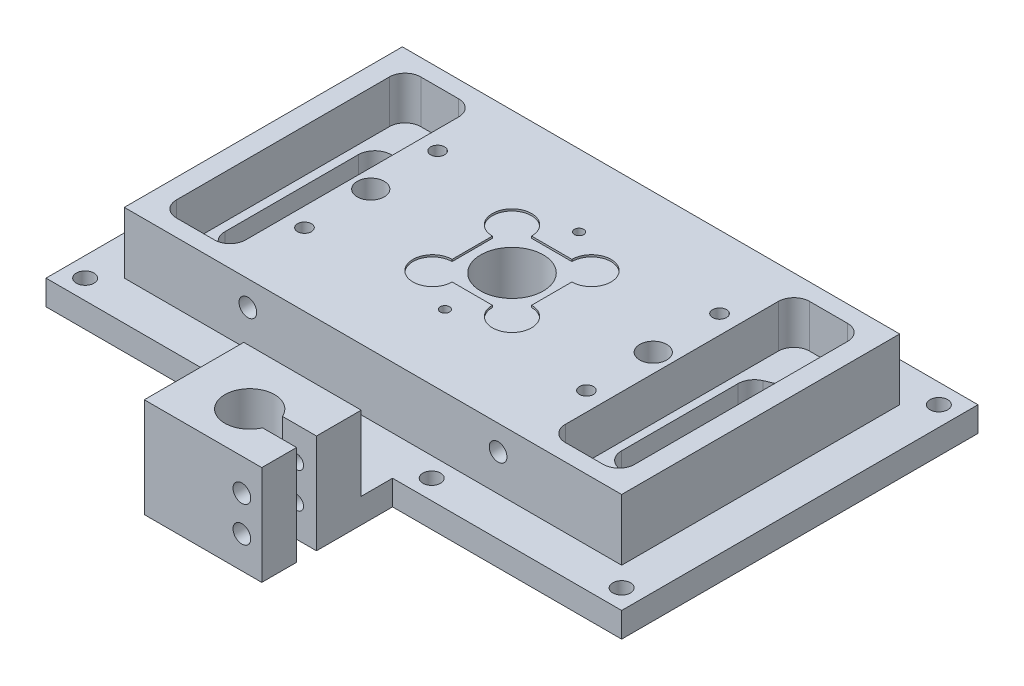
from build123d import *

# Parameters (mm, degrees)
MAIN_SKETCH_W                           = 73.5
MAIN_SKETCH_H                           = 45.5
MAIN_SKETCH_W_2                         = 63.5
MAIN_SKETCH_H_2                         = 35.5
LIP_DEPTH                               = 3.175
MOUNTING_BASE_OUTLINE_W                 = 63.5
MOUNTING_BASE_OUTLINE_H                 = 35.5
MOUNTING_BASE_OUTLINE_R                 = 1.7272
MOUNTING_BASE_OUTLINE_R_2               = 4
MOUNTING_BASE_DEPTH                     = 11
HEATER_CART_4_40_TAPS_D                 = 2.2606
HEATER_CART_4_40_TAPS_DEPTH             = 7.595
HEATER_CART_4_40_TAPS_TIP               = 0.679152758
HEATER_CART_4_40_TAPS_ON_FACE_2_D       = 2.2606
HEATER_CART_4_40_TAPS_ON_FACE_2_DEPTH   = 7.595
HEATER_CART_4_40_TAPS_ON_FACE_2_TIP     = 0.679152758
MAIN_SKETCH_12_W                        = 8.85
MAIN_SKETCH_12_H                        = 31.2
BOTTOM_SQUARE_CUTOUT_DEPTH              = 2
SQUARE_MICRO_D_CUTOUT_START             = 5.5
SQUARE_MICRO_D_CUTOUT_OUTLINE_W         = 8.85
SQUARE_MICRO_D_CUTOUT_OUTLINE_H         = 31.2
SQUARE_MICRO_D_CUTOUT_DEPTH             = 5.5
MAIN_SKETCH_7_R                         = 0.285
ROUND_MICRO_D_CUTOUT_DEPTH              = 11
INTERNAL_CORNER_CUTOUTS_FILLET_R        = 2
CHIP_CLAMP_0_80_TAPS_AT_2_COUNT         = 2
CHIP_CLAMP_0_80_TAPS_AT_2_PITCH         = 17.1232
CHIP_CLAMP_0_80_TAPS_AT_3_COUNT         = 2
CHIP_CLAMP_0_80_TAPS_AT_3_PITCH         = 17.1232
CHIP_POCKET_START                       = 11
MAIN_SKETCH_6_R                         = 2.5
MAIN_SKETCH_6_W                         = 10.15
MAIN_SKETCH_6_H                         = 10.15
CHIP_POCKET_DEPTH                       = 0.25
F_2_56_CLOSE_CLEAR_43_0_089_D           = 2.2606
F_2_56_CLOSE_CLEAR_43_0_089_ON_FACE_2_D = 2.2606
PCB_2_56_TAPS_D                         = 1.778
PCB_2_56_TAPS_DEPTH                     = 5.734
PCB_2_56_TAPS_TIP                       = 0.53416509
BOTTOM_COVER_2_56_TAPS_D                = 1.778
BOTTOM_COVER_2_56_TAPS_DEPTH            = 5.734
BOTTOM_COVER_2_56_TAPS_TIP              = 0.53416509
C_CLAMP_SKETCH_W                        = 15
C_CLAMP_SKETCH_H                        = 4
CCLAMP_BRIDGE_DEPTH                     = 3.175
C_CLAMP_START                           = -3.175
C_CLAMP_DEPTH                           = 12.7
C_CLAMP_HOLE_LOCS_R                     = 1.1303
F_2_56_CLSOE_FIT_THRU_DEPTH             = 4.445
F_2_56_TAPPED_HOLE2_D                   = 1.778
F_2_56_TAPPED_HOLE2_DEPTH               = 14.715


# Read off the part's stored shape, not the designer's step: Mounting_Base, Square_Micro_D_Cutout
with BuildPart() as part:
    # Main_Sketch → Lip (new body)
    with BuildSketch(Plane(origin=(0, 0, 0), x_dir=(1, 0, 0), z_dir=(0, 1, 0))):
        with Locations((36.75, -22.75)):
            Rectangle(MAIN_SKETCH_W, MAIN_SKETCH_H)
        with Locations((36.75, -22.75)):
            Rectangle(MAIN_SKETCH_W_2, MAIN_SKETCH_H_2, mode=Mode.SUBTRACT)
    extrude(amount=LIP_DEPTH)

    # Mounting_Base outline → Mounting_Base (add)
    with BuildSketch(Plane(origin=(0, 0, 0), x_dir=(1, 0, 0), z_dir=(0, 1, 0))):
        with Locations((36.75, -22.75)):
            Rectangle(MOUNTING_BASE_OUTLINE_W, MOUNTING_BASE_OUTLINE_H)
        with Locations((18.715, -22.75)):
            Circle(MOUNTING_BASE_OUTLINE_R, mode=Mode.SUBTRACT)
        with Locations((36.75, -22.75)):
            Circle(MOUNTING_BASE_OUTLINE_R_2, mode=Mode.SUBTRACT)
        with Locations((54.785, -22.75)):
            Circle(MOUNTING_BASE_OUTLINE_R, mode=Mode.SUBTRACT)
    extrude(amount=MOUNTING_BASE_DEPTH)

    # Heater_Cart_#4-40_Taps
    with Locations(Plane(origin=(52.725, 7.825, 5), x_dir=(-1, 0, 0), z_dir=(0, 0, -1))):
        with Locations((0, 0), (31.95, 0)):
            Hole(HEATER_CART_4_40_TAPS_D / 2, depth=HEATER_CART_4_40_TAPS_DEPTH)
            with Locations((0, 0, -(HEATER_CART_4_40_TAPS_DEPTH + HEATER_CART_4_40_TAPS_TIP / 2))):  # 118° drill point
                Cone(0, HEATER_CART_4_40_TAPS_D / 2, HEATER_CART_4_40_TAPS_TIP, mode=Mode.SUBTRACT)

    # Heater_Cart_#4-40_Taps on face 2
    with Locations(Plane(origin=(20.775, 7.825, 40.5), x_dir=(1, 0, 0), z_dir=(0, 0, 1))):
        with Locations((0, 0), (31.95, 0)):
            Hole(HEATER_CART_4_40_TAPS_ON_FACE_2_D / 2, depth=HEATER_CART_4_40_TAPS_ON_FACE_2_DEPTH)
            with Locations((0, 0, -(HEATER_CART_4_40_TAPS_ON_FACE_2_DEPTH + HEATER_CART_4_40_TAPS_ON_FACE_2_TIP / 2))):  # 118° drill point
                Cone(0, HEATER_CART_4_40_TAPS_ON_FACE_2_D / 2, HEATER_CART_4_40_TAPS_ON_FACE_2_TIP, mode=Mode.SUBTRACT)

    # Main_Sketch<12> → Bottom_square_cutout (cut)
    with BuildSketch(Plane(origin=(0, 0, 0), x_dir=(1, 0, 0), z_dir=(0, 1, 0))):
        with Locations((11.925, -22.75)):
            Rectangle(MAIN_SKETCH_12_W, MAIN_SKETCH_12_H)
        with BuildLine():
            ThreePointArc((11.521574965, -33.196222286), (10.496212222, -33.351578951), (9.521946869, -32.996175702))
            ThreePointArc((9.521946869, -32.996175702), (8.851632057, -32.244424217), (8.609546604, -31.26675))
            Line((8.609546604, -31.26675), (8.609546604, -14.23325))
            ThreePointArc((8.609546604, -14.23325), (8.851632057, -13.255575783), (9.521946869, -12.503824298))
            ThreePointArc((9.521946869, -12.503824298), (10.496212222, -12.148421049), (11.521574965, -12.303777714))
            Line((11.521574965, -12.303777714), (14.054010046, -13.37581902))
            ThreePointArc((14.054010046, -13.37581902), (14.983840891, -14.148001292), (15.3324534, -15.305291306))
            Line((15.3324534, -15.305291306), (15.3324534, -30.194708694))
            ThreePointArc((15.3324534, -30.194708694), (14.983840891, -31.351998708), (14.054010046, -32.12418098))
            Line((14.054010046, -32.12418098), (11.521574965, -33.196222286))
        make_face(mode=Mode.SUBTRACT)
    bottom_square_cutout = extrude(amount=BOTTOM_SQUARE_CUTOUT_DEPTH, mode=Mode.SUBTRACT)

    # Square_Micro_D_Cutout outline → Square_Micro_D_Cutout (cut)
    with BuildSketch(Plane(origin=(0, 0, 0), x_dir=(1, 0, 0), z_dir=(0, 1, 0)).offset(SQUARE_MICRO_D_CUTOUT_START)):
        with Locations((11.925, -22.75)):
            Rectangle(SQUARE_MICRO_D_CUTOUT_OUTLINE_W, SQUARE_MICRO_D_CUTOUT_OUTLINE_H)
        with BuildLine():
            ThreePointArc((11.521574965, -33.196222286), (9.547492447, -33.013373348), (8.609546604, -31.26675))
            Line((8.609546604, -31.26675), (8.609546604, -14.23325))
            ThreePointArc((8.609546604, -14.23325), (9.547492447, -12.486626652), (11.521574965, -12.303777714))
            Line((11.521574965, -12.303777714), (14.054010046, -13.37581902))
            ThreePointArc((14.054010046, -13.37581902), (14.983840891, -14.148001291), (15.3324534, -15.305291306))
            Line((15.3324534, -15.305291306), (15.3324534, -30.194708694))
            ThreePointArc((15.3324534, -30.194708694), (14.983840891, -31.351998709), (14.054010046, -32.12418098))
            Line((14.054010046, -32.12418098), (11.521574965, -33.196222286))
        make_face(mode=Mode.SUBTRACT)
    square_micro_d_cutout = extrude(amount=SQUARE_MICRO_D_CUTOUT_DEPTH, mode=Mode.SUBTRACT)

    # Main_Sketch<7> → Round_Micro_D_Cutout (cut)
    # profile 1 of 2: a face of its own
    with BuildSketch(Plane(origin=(0, 0, 0), x_dir=(1, 0, 0), z_dir=(0, 1, 0))):
        with BuildLine():
            ThreePointArc((9.521946869, -32.996175702), (8.851632057, -32.244424217), (8.609546604, -31.26675))
            Line((8.609546604, -31.26675), (8.609546604, -14.23325))
            ThreePointArc((8.609546604, -14.23325), (8.851632057, -13.255575783), (9.521946869, -12.503824298))
            ThreePointArc((9.521946869, -12.503824298), (10.496212222, -12.148421049), (11.521574965, -12.303777714))
            Line((11.521574965, -12.303777714), (14.054010046, -13.37581902))
            ThreePointArc((14.054010046, -13.37581902), (14.983840891, -14.148001292), (15.3324534, -15.305291306))
            Line((15.3324534, -15.305291306), (15.3324534, -30.194708694))
            ThreePointArc((15.3324534, -30.194708694), (14.983840891, -31.351998708), (14.054010046, -32.12418098))
            Line((14.054010046, -32.12418098), (11.521574965, -33.196222286))
            ThreePointArc((11.521574965, -33.196222286), (10.496212222, -33.351578951), (9.521946869, -32.996175702))
        make_face()
        with Locations((11.399546604, -22.75)):
            Circle(MAIN_SKETCH_7_R, mode=Mode.SUBTRACT)
    # profile 2 of 2: a face of its own
    with BuildSketch(Plane(origin=(0, 0, 0), x_dir=(1, 0, 0), z_dir=(0, 1, 0))):
        with Locations((11.399546604, -22.75)):
            Circle(MAIN_SKETCH_7_R)
    round_micro_d_cutout = extrude(amount=ROUND_MICRO_D_CUTOUT_DEPTH, mode=Mode.SUBTRACT)

    # MicroD_Mirror: Bottom_square_cutout, Square_Micro_D_Cutout, Round_Micro_D_Cutout across plane
    add(bottom_square_cutout.mirror(Plane(origin=(36.75, 0, 0), x_dir=(0, 0, 1), z_dir=(1, 0, 0))), mode=Mode.SUBTRACT)
    add(square_micro_d_cutout.mirror(Plane(origin=(36.75, 0, 0), x_dir=(0, 0, 1), z_dir=(1, 0, 0))), mode=Mode.SUBTRACT)
    add(round_micro_d_cutout.mirror(Plane(origin=(36.75, 0, 0), x_dir=(0, 0, 1), z_dir=(1, 0, 0))), mode=Mode.SUBTRACT)

    # Internal_Corner_cutouts_fillet
    internal_corner_cutouts_fillet_edges = [part.edges().sort_by_distance(p)[0] for p in [
        (16.35, 8.25, 38.35),
        (7.5, 8.25, 38.35),
        (7.5, 8.25, 7.15),
        (16.35, 8.25, 7.15),
        (57.15, 1, 7.15),
        (57.15, 1, 38.35),
        (66, 1, 38.35),
        (66, 1, 7.15),
        (66, 8.25, 7.15),
        (66, 8.25, 38.35),
        (57.15, 8.25, 38.35),
        (57.15, 8.25, 7.15),
        (16.35, 1, 38.35),
        (16.35, 1, 7.15),
        (7.5, 1, 7.15),
        (7.5, 1, 38.35),
    ]]
    fillet(internal_corner_cutouts_fillet_edges, radius=INTERNAL_CORNER_CUTOUTS_FILLET_R)

    # Sketch3 → Chip_Clamp_#0-80 Taps (revolve, cut)
    with BuildSketch(Plane(origin=(36.75, 11, 31.3116), x_dir=(0, 0, 1), z_dir=(1, 0, 0))):
        Polygon((0, 0), (0, 4.358890611), (0.59563, 4.001), (0.59563, 0), align=None)
    chip_clamp_0_80_taps = revolve(axis=Axis((36.75, 17.35, 31.3116), (0, -1, 0)), mode=Mode.SUBTRACT)

    # Chip_Clamp_#0-80 Taps at 2: Chip_Clamp_#0-80 Taps ×2
    with Locations(*[(0, 0, -i * CHIP_CLAMP_0_80_TAPS_AT_2_PITCH) for i in range(1, CHIP_CLAMP_0_80_TAPS_AT_2_COUNT)]):
        add(chip_clamp_0_80_taps, mode=Mode.SUBTRACT)

    # Chip_Clamp_#0-80 Taps at 3: Chip_Clamp_#0-80 Taps ×2
    with Locations(*[(0, 0, -i * CHIP_CLAMP_0_80_TAPS_AT_3_PITCH) for i in range(1, CHIP_CLAMP_0_80_TAPS_AT_3_COUNT)]):
        add(chip_clamp_0_80_taps, mode=Mode.SUBTRACT)

    # Main_Sketch<6> → Chip_Pocket (cut)
    with BuildSketch(Plane(origin=(0, 0, 0), x_dir=(1, 0, 0), z_dir=(0, 1, 0)).offset(CHIP_POCKET_START)):
        with BuildLine():
            Line((31.675, -20.175), (31.675, -17.675))
            Line((31.675, -17.675), (34.175, -17.675))
            ThreePointArc((34.175, -17.675), (29.907233047, -15.907233047), (31.675, -20.175))
        make_face()
        with BuildLine():
            Line((34.175, -17.675), (31.675, -17.675))
            Line((31.675, -17.675), (31.675, -20.175))
            ThreePointArc((31.675, -20.175), (33.442766953, -19.442766953), (34.175, -17.675))
        make_face()
        with BuildLine():
            ThreePointArc((44.325, -17.675), (41.825, -15.175), (39.325, -17.675))
            Line((39.325, -17.675), (41.825, -17.675))
            Line((41.825, -17.675), (41.825, -20.175))
            ThreePointArc((41.825, -20.175), (43.592766953, -19.442766953), (44.325, -17.675))
        make_face()
        with BuildLine():
            Line((41.825, -17.675), (39.325, -17.675))
            ThreePointArc((39.325, -17.675), (40.057233047, -19.442766953), (41.825, -20.175))
            Line((41.825, -20.175), (41.825, -17.675))
        make_face()
        with BuildLine():
            ThreePointArc((34.175, -27.825), (33.442766953, -26.057233047), (31.675, -25.325))
            Line((31.675, -25.325), (31.675, -27.825))
            Line((31.675, -27.825), (34.175, -27.825))
        make_face()
        with BuildLine():
            Line((31.675, -27.825), (31.675, -25.325))
            ThreePointArc((31.675, -25.325), (29.907233047, -29.592766953), (34.175, -27.825))
            Line((34.175, -27.825), (31.675, -27.825))
        make_face()
        with BuildLine():
            ThreePointArc((44.325, -27.825), (43.592766953, -26.057233047), (41.825, -25.325))
            Line((41.825, -25.325), (41.825, -27.825))
            Line((41.825, -27.825), (39.325, -27.825))
            ThreePointArc((39.325, -27.825), (41.825, -30.325), (44.325, -27.825))
        make_face()
        with BuildLine():
            Line((41.825, -27.825), (41.825, -25.325))
            ThreePointArc((41.825, -25.325), (40.057233047, -26.057233047), (39.325, -27.825))
            Line((39.325, -27.825), (41.825, -27.825))
        make_face()
        with Locations((41.825, -27.825)):
            Circle(MAIN_SKETCH_6_R)
        with Locations((41.825, -17.675)):
            Circle(MAIN_SKETCH_6_R)
        with Locations((31.675, -17.675)):
            Circle(MAIN_SKETCH_6_R)
        with Locations((31.675, -27.825)):
            Circle(MAIN_SKETCH_6_R)
        with Locations((36.75, -22.75)):
            Rectangle(MAIN_SKETCH_6_W, MAIN_SKETCH_6_H)
    extrude(amount=-CHIP_POCKET_DEPTH, mode=Mode.SUBTRACT)

    # 2-56_Close_Clear#43 (0.089) (through all)
    with Locations(Plane(origin=(2.5, 3.175, 2.5), x_dir=(0, 0, 1), z_dir=(0, 1, 0))):
        with Locations((0, 0), (40.5, 24.25), (0, 68.5), (0, 44.25), (40.5, 68.5), (40.5, 44.25), (40.5, 0), (0, 24.25)):
            Hole(F_2_56_CLOSE_CLEAR_43_0_089_D / 2)

    # 2-56_Close_Clear#43 (0.089) on face 2 (through all)
    with Locations(Plane(origin=(26.75, 0, 43), x_dir=(0, 0, -1), z_dir=(0, -1, 0))):
        with Locations((0, 0), (40.5, 44.25), (40.5, 20), (0, 44.25), (0, 20), (0, -24.25), (40.5, 0)):
            Hole(F_2_56_CLOSE_CLEAR_43_0_089_ON_FACE_2_D / 2)

    # PCB #2-56 Taps
    with Locations(Plane(origin=(18.75, 11, 14.25), x_dir=(0, 0, 1), z_dir=(0, 1, 0))):
        with Locations((0, 0), (17, 0), (0, 36), (17, 36)):
            Hole(PCB_2_56_TAPS_D / 2, depth=PCB_2_56_TAPS_DEPTH)
            with Locations((0, 0, -(PCB_2_56_TAPS_DEPTH + PCB_2_56_TAPS_TIP / 2))):  # 118° drill point
                Cone(0, PCB_2_56_TAPS_D / 2, PCB_2_56_TAPS_TIP, mode=Mode.SUBTRACT)

    # Bottom_Cover#2-56 Taps
    with Locations(Plane(origin=(54.785, 0, 18.75), x_dir=(0, 0, -1), z_dir=(0, -1, 0))):
        with Locations((0, 0), (-8, 0), (-8, -36.07), (0, -36.07)):
            Hole(BOTTOM_COVER_2_56_TAPS_D / 2, depth=BOTTOM_COVER_2_56_TAPS_DEPTH)
            with Locations((0, 0, -(BOTTOM_COVER_2_56_TAPS_DEPTH + BOTTOM_COVER_2_56_TAPS_TIP / 2))):  # 118° drill point
                Cone(0, BOTTOM_COVER_2_56_TAPS_D / 2, BOTTOM_COVER_2_56_TAPS_TIP, mode=Mode.SUBTRACT)

    # c_clamp_sketch → cclamp_bridge (add)
    with BuildSketch(Plane(origin=(0, 3.175, 0), x_dir=(1, 0, 0), z_dir=(0, 1, 0))):
        with Locations((36.75, -47.5)):
            Rectangle(C_CLAMP_SKETCH_W, C_CLAMP_SKETCH_H)
    extrude(amount=-CCLAMP_BRIDGE_DEPTH)

    # c_clamp_sketch<4> → c_clamp (add)
    with BuildSketch(Plane(origin=(0, 3.175, 0), x_dir=(1, 0, 0), z_dir=(0, 1, 0)).offset(C_CLAMP_START)):
        with BuildLine():
            Line((44.25, -55.215), (44.25, -49.5))
            Line((44.25, -49.5), (29.25, -49.5))
            Line((29.25, -49.5), (29.25, -62.2))
            Line((29.25, -62.2), (44.25, -62.2))
            Line((44.25, -62.2), (44.25, -57.755))
            Line((44.25, -57.755), (39.906935566, -57.755))
            ThreePointArc((39.906935566, -57.755), (33.822, -56.485), (39.906935566, -55.215))
            Line((39.906935566, -55.215), (44.25, -55.215))
        make_face()
    extrude(amount=C_CLAMP_DEPTH)

    # c_clamp_hole_locs → 2-56_clsoe_fit_thru (cut)
    with BuildSketch(Plane.XY.offset(62.2)):
        with Locations((41.71, 8.6)):
            Circle(C_CLAMP_HOLE_LOCS_R)
        with Locations((41.71, 4.1)):
            Circle(C_CLAMP_HOLE_LOCS_R)
    extrude(amount=-F_2_56_CLSOE_FIT_THRU_DEPTH, mode=Mode.SUBTRACT)

    # #2-56 Tapped Hole2
    with Locations(Plane(origin=(41.71, 8.6, 55.215), x_dir=(1, 0, 0), z_dir=(0, 0, 1))):
        with Locations((0, 0), (0, -4.5)):
            Hole(F_2_56_TAPPED_HOLE2_D / 2, depth=F_2_56_TAPPED_HOLE2_DEPTH)


solid = part.part
